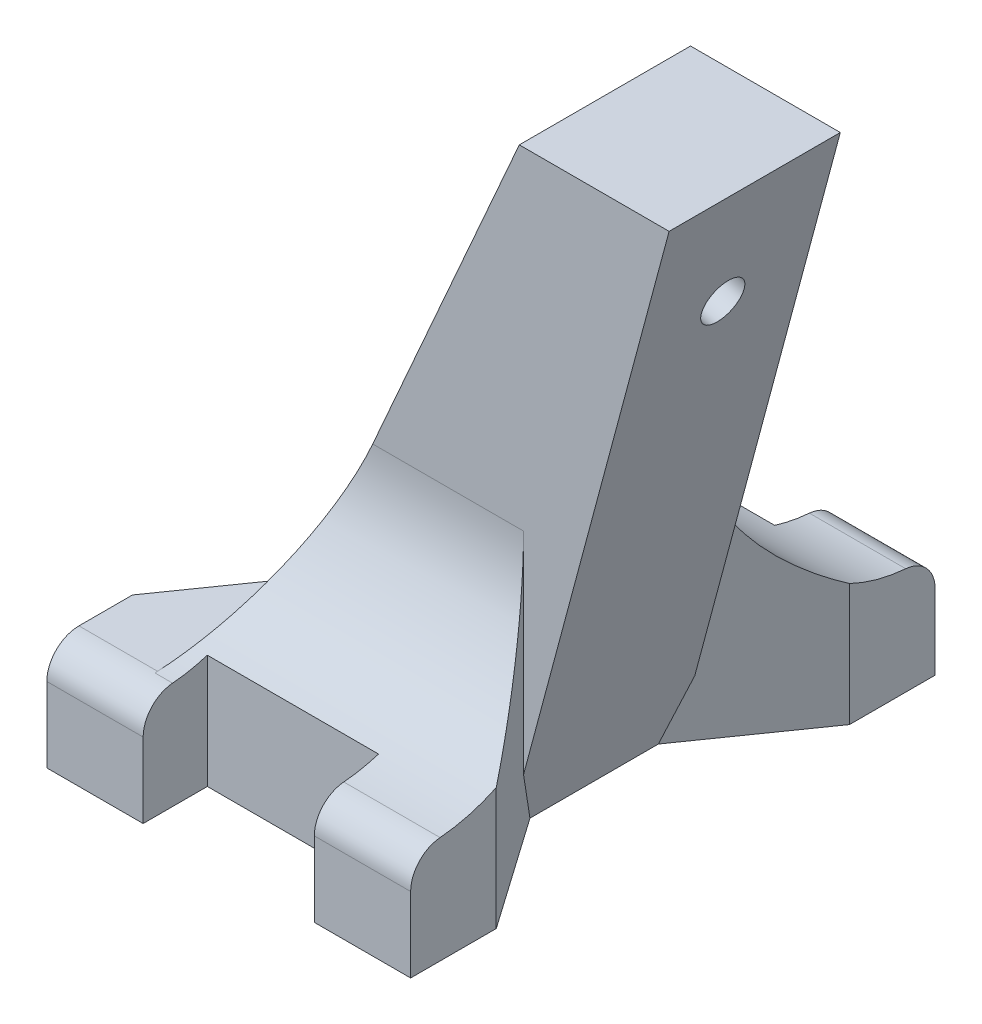
from build123d import *

# Parameters (mm, degrees)
SALIENTE_EXTRUIR1_DEPTH = 10
REDONDEO1_R             = 3
SALIENTE_EXTRUIR2_DEPTH = 8
REDONDEO2_R             = 15
CROQUIS6_R              = 2
CORTAR_EXTRUIR1_DEPTH   = 69.470668674
CROQUIS7_R              = 3.5
CROQUIS7_R_2            = 2.023814415
SALIENTE_EXTRUIR4_DEPTH = 1


with BuildPart() as part:
    # Croquis1 → Saliente-Extruir1 (new body)
    with BuildSketch(Plane(origin=(0, 0, 0), x_dir=(1, 0, 0), z_dir=(0, 1, 0))):
        Polygon((8, 18.51), (8, 24.51), (17, 24.51), (17, 16.51), (9.640818773, 6), (9.640818773, -6), (17, -16.51), (17, -24.51), (8, -24.51), (8, -18.51), (-8, -18.51), (-8, -24.51), (-17, -24.51), (-17, -16.51), (-9.640818773, -6), (-9.640818773, 6), (-17, 16.51), (-17, 24.51), (-8, 24.51), (-8, 18.51), align=None)
    extrude(amount=SALIENTE_EXTRUIR1_DEPTH)

    # Redondeo1
    redondeo1_edges = [part.edges().sort_by_distance(p)[0] for p in [
        (12.5, 10, -24.51),
        (-12.5, 10, -24.51),
        (-12.5, 10, 24.51),
        (12.5, 10, 24.51),
    ]]
    fillet(redondeo1_edges, radius=REDONDEO1_R)

    # Croquis4 → Saliente-Extruir2 (add, symmetric)
    with BuildSketch(Plane.XY):
        Polygon((9.640818773, 0), (24.64597355, 56), (10.64597355, 56), (-9.640818773, 10), (-9.640818773, 0), align=None)
    extrude(amount=SALIENTE_EXTRUIR2_DEPTH, both=True)

    # Redondeo2
    # the kernel refuses this fillet: 15 mm, written as the material it adds along each edge
    with BuildSketch(Plane(origin=(48.386795224, 10, 8), x_dir=(0, -0.0007483395866258935, 0.9999997199938924), z_dir=(-1, 0, 0))) as redondeo2_piece_1_section:
        with BuildLine():
            CenterArc((14.988816935, 14.949445461), REDONDEO2_R, 180.042876704, 85.251749502)
            Line((-0.011178865, 14.938220367), (-1.511178445, 14.937097858))
            Line((-1.511178445, 14.937097858), (-1.49999958, -0.001122509))
            Line((-1.49999958, -0.001122509), (0.001122509, -1.49999958))
            ThreePointArc((0.001122509, -1.49999958), (13.511118726, -1.489889512), (13.635289211, -1.494944546))
            Line((13.635289211, -1.494944546), (13.758337186, 0))
        make_face()
    redondeo2_piece_1 = extrude(amount=95.373175372, mode=Mode.PRIVATE)
    redondeo2_piece_1 = split(redondeo2_piece_1, bisect_by=Plane(origin=(8, 10, 8), z_dir=(1, 0, 0)), keep=Keep.TOP, mode=Mode.PRIVATE)
    redondeo2_piece_1 = split(redondeo2_piece_1, bisect_by=Plane(origin=(17, 10, 8), z_dir=(-1, 0, 0)), keep=Keep.TOP, mode=Mode.PRIVATE)
    redondeo2_piece_1 = split(redondeo2_piece_1, bisect_by=Plane(origin=(23.32754741, 10, 25.546674221), z_dir=(-0.8191520442889914, 0, 0.5735764363510469)), keep=Keep.TOP, mode=Mode.PRIVATE)
    add(redondeo2_piece_1)
    with BuildSketch(Plane(origin=(48.386795224, 10, 8), x_dir=(0, -0.0007483395866258935, 0.9999997199938924), z_dir=(-1, 0, 0))) as redondeo2_piece_2_section:
        with BuildLine():
            CenterArc((14.988816935, 14.949445461), REDONDEO2_R, 180.042876704, 85.251749502)
            Line((-0.011178865, 14.938220367), (-1.511178445, 14.937097858))
            Line((-1.511178445, 14.937097858), (-1.49999958, -0.001122509))
            Line((-1.49999958, -0.001122509), (0.001122509, -1.49999958))
            ThreePointArc((0.001122509, -1.49999958), (13.511118726, -1.489889512), (13.635289211, -1.494944546))
            Line((13.635289211, -1.494944546), (13.758337186, 0))
        make_face()
    redondeo2_piece_2 = extrude(amount=95.373175372, mode=Mode.PRIVATE)
    redondeo2_piece_2 = split(redondeo2_piece_2, bisect_by=Plane(origin=(-0.192358376, 31.424243485, 8), z_dir=(0.9149716022207091, -0.4035182364276348, 0)), keep=Keep.TOP, mode=Mode.PRIVATE)
    redondeo2_piece_2 = split(redondeo2_piece_2, bisect_by=Plane(origin=(48.386795224, 10, 18.51), z_dir=(0, 0, -1)), keep=Keep.TOP, mode=Mode.PRIVATE)
    redondeo2_piece_2 = split(redondeo2_piece_2, bisect_by=Plane(origin=(17, 10, 8), z_dir=(-1, 0, 0)), keep=Keep.TOP, mode=Mode.PRIVATE)
    redondeo2_piece_2 = split(redondeo2_piece_2, bisect_by=Plane(origin=(23.32754741, 10, 25.546674221), z_dir=(-0.8191520442889914, 0, 0.5735764363510469)), keep=Keep.TOP, mode=Mode.PRIVATE)
    add(redondeo2_piece_2)
    with BuildSketch(Plane(origin=(48.386795224, 10, 8), x_dir=(0, -0.0007483395866258935, 0.9999997199938924), z_dir=(-1, 0, 0))) as redondeo2_piece_3_section:
        with BuildLine():
            CenterArc((14.988816935, 14.949445461), REDONDEO2_R, 180.042876704, 85.251749502)
            Line((-0.011178865, 14.938220367), (-1.511178445, 14.937097858))
            Line((-1.511178445, 14.937097858), (-1.49999958, -0.001122509))
            Line((-1.49999958, -0.001122509), (0.001122509, -1.49999958))
            ThreePointArc((0.001122509, -1.49999958), (13.511118726, -1.489889512), (13.635289211, -1.494944546))
            Line((13.635289211, -1.494944546), (13.758337186, 0))
        make_face()
    redondeo2_piece_3 = extrude(amount=95.373175372, mode=Mode.PRIVATE)
    redondeo2_piece_3 = split(redondeo2_piece_3, bisect_by=Plane(origin=(-0.192358376, 31.424243485, 8), z_dir=(0.9149716022207091, -0.4035182364276348, 0)), keep=Keep.TOP, mode=Mode.PRIVATE)
    redondeo2_piece_3 = split(redondeo2_piece_3, bisect_by=Plane(origin=(-8, 10, 8), z_dir=(-1, 0, 0)), keep=Keep.TOP, mode=Mode.PRIVATE)
    add(redondeo2_piece_3)
    with BuildSketch(Plane(origin=(48.386795224, 10, -8), x_dir=(0, -0.0007483395866258937, -0.9999997199938924), z_dir=(-1, 0, 0))) as redondeo2_piece_4_section:
        with BuildLine():
            CenterArc((14.988816935, -14.949445461), REDONDEO2_R, 94.705373794, 85.251749502)
            Line((-0.011178865, -14.938220367), (-1.511178445, -14.937097858))
            Line((-1.511178445, -14.937097858), (-1.49999958, 0.001122509))
            Line((-1.49999958, 0.001122509), (0.001122509, 1.49999958))
            ThreePointArc((0.001122509, 1.49999958), (13.511118726, 1.489889512), (13.635289211, 1.494944546))
            Line((13.635289211, 1.494944546), (13.758337186, 0))
        make_face()
    redondeo2_piece_4 = extrude(amount=95.373175372, mode=Mode.PRIVATE)
    redondeo2_piece_4 = split(redondeo2_piece_4, bisect_by=Plane(origin=(8, 10, -8), z_dir=(1, 0, 0)), keep=Keep.TOP, mode=Mode.PRIVATE)
    redondeo2_piece_4 = split(redondeo2_piece_4, bisect_by=Plane(origin=(17, 10, -8), z_dir=(-1, 0, 0)), keep=Keep.TOP, mode=Mode.PRIVATE)
    redondeo2_piece_4 = split(redondeo2_piece_4, bisect_by=Plane(origin=(23.32754741, 10, -25.546674221), z_dir=(-0.8191520442889914, 0, -0.5735764363510469)), keep=Keep.TOP, mode=Mode.PRIVATE)
    add(redondeo2_piece_4)
    with BuildSketch(Plane(origin=(48.386795224, 10, -8), x_dir=(0, -0.0007483395866258937, -0.9999997199938924), z_dir=(-1, 0, 0))) as redondeo2_piece_5_section:
        with BuildLine():
            CenterArc((14.988816935, -14.949445461), REDONDEO2_R, 94.705373794, 85.251749502)
            Line((-0.011178865, -14.938220367), (-1.511178445, -14.937097858))
            Line((-1.511178445, -14.937097858), (-1.49999958, 0.001122509))
            Line((-1.49999958, 0.001122509), (0.001122509, 1.49999958))
            ThreePointArc((0.001122509, 1.49999958), (13.511118726, 1.489889512), (13.635289211, 1.494944546))
            Line((13.635289211, 1.494944546), (13.758337186, 0))
        make_face()
    redondeo2_piece_5 = extrude(amount=95.373175372, mode=Mode.PRIVATE)
    redondeo2_piece_5 = split(redondeo2_piece_5, bisect_by=Plane(origin=(48.386795224, 10, -18.51), z_dir=(0, 0, 1)), keep=Keep.TOP, mode=Mode.PRIVATE)
    redondeo2_piece_5 = split(redondeo2_piece_5, bisect_by=Plane(origin=(23.32754741, 10, -25.546674221), z_dir=(-0.8191520442889914, 0, -0.5735764363510469)), keep=Keep.TOP, mode=Mode.PRIVATE)
    redondeo2_piece_5 = split(redondeo2_piece_5, bisect_by=Plane(origin=(-0.192358376, 31.424243485, -8), z_dir=(0.9149716022207091, -0.4035182364276348, 0)), keep=Keep.TOP, mode=Mode.PRIVATE)
    redondeo2_piece_5 = split(redondeo2_piece_5, bisect_by=Plane(origin=(14.736307048, 19.016621132, -8), z_dir=(-0.9659258262890673, 0.2588190451025247, 0)), keep=Keep.TOP, mode=Mode.PRIVATE)
    add(redondeo2_piece_5)
    with BuildSketch(Plane(origin=(48.386795224, 10, -8), x_dir=(0, -0.0007483395866258937, -0.9999997199938924), z_dir=(-1, 0, 0))) as redondeo2_piece_6_section:
        with BuildLine():
            CenterArc((14.988816935, -14.949445461), REDONDEO2_R, 94.705373794, 85.251749502)
            Line((-0.011178865, -14.938220367), (-1.511178445, -14.937097858))
            Line((-1.511178445, -14.937097858), (-1.49999958, 0.001122509))
            Line((-1.49999958, 0.001122509), (0.001122509, 1.49999958))
            ThreePointArc((0.001122509, 1.49999958), (13.511118726, 1.489889512), (13.635289211, 1.494944546))
            Line((13.635289211, 1.494944546), (13.758337186, 0))
        make_face()
    redondeo2_piece_6 = extrude(amount=95.373175372, mode=Mode.PRIVATE)
    redondeo2_piece_6 = split(redondeo2_piece_6, bisect_by=Plane(origin=(-8, 10, -8), z_dir=(-1, 0, 0)), keep=Keep.TOP, mode=Mode.PRIVATE)
    redondeo2_piece_6 = split(redondeo2_piece_6, bisect_by=Plane(origin=(-0.192358376, 31.424243485, -8), z_dir=(0.9149716022207091, -0.4035182364276348, 0)), keep=Keep.TOP, mode=Mode.PRIVATE)
    add(redondeo2_piece_6)

    # Croquis6 → Cortar-Extruir1 (cut, through all)
    with BuildSketch(Plane(origin=(8.995006372, -2.410204693, 0), x_dir=(0, 0, -1), z_dir=(0.9659258262890673, -0.25881904510252474, 0))):
        with Locations(Location((0, 48.930693612, 0), (0, 0, 90))):
            Circle(CROQUIS6_R)
    extrude(amount=-CORTAR_EXTRUIR1_DEPTH, mode=Mode.SUBTRACT)

    # Croquis7 → Saliente-Extruir4 (add)
    with BuildSketch(Plane(origin=(-11.763110765, 5.18773446, 0), x_dir=(0, 0, 1), z_dir=(-0.9149716022207091, 0.40351823642763496, 0))):
        with Locations(Location((0, 47.523457021, 0), (0, 0, 90))):
            Circle(CROQUIS7_R)
        with Locations(Location((0, 47.523457021, 0), (0, 0, 270))):
            Circle(CROQUIS7_R_2, mode=Mode.SUBTRACT)
    extrude(amount=SALIENTE_EXTRUIR4_DEPTH)


solid = part.part
